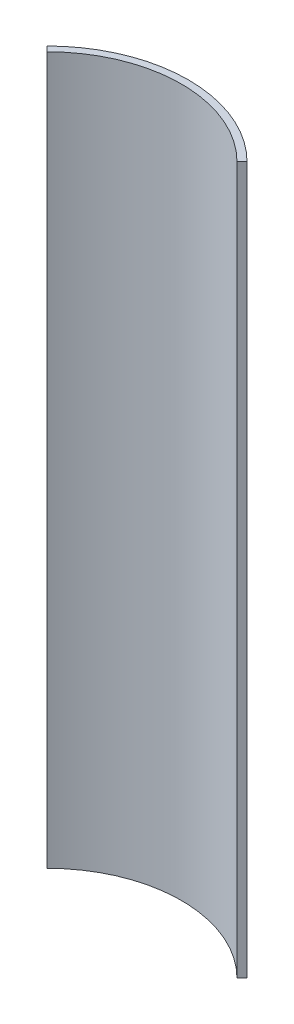
from build123d import *

# Parameters (mm, degrees)
SKETCH1_W          = 3
SKETCH1_H          = 300
SKETCH6_OUTSIDE_W  = 190.934
SKETCH6_OUTSIDE_H  = 190.934
CUT_EXTRUDE2_DEPTH = 312.769145362


with BuildPart() as part:
    # Sketch1 → Revolve1 (revolve)
    with BuildSketch(Plane.XY):
        with Locations((58.5, 0)):
            Rectangle(SKETCH1_W, SKETCH1_H)
    revolve(axis=Axis((0, 0, 0), (0, 1, 0)))

    # Sketch6 outside → Cut-Extrude2 (cut, through all)
    with BuildSketch(Plane(origin=(0, 150, 0), x_dir=(1, 0, 0), z_dir=(0, 1, 0))):
        Rectangle(SKETCH6_OUTSIDE_W, SKETCH6_OUTSIDE_H)
        with BuildLine():
            Line((0, 0), (-42.426406871, 42.426406871))
            ThreePointArc((-42.426406871, 42.426406871), (0, 60), (42.426406871, 42.426406871))
            Line((42.426406871, 42.426406871), (0, 0))
        make_face(mode=Mode.SUBTRACT)
    extrude(amount=-CUT_EXTRUDE2_DEPTH, mode=Mode.SUBTRACT)


solid = part.part
